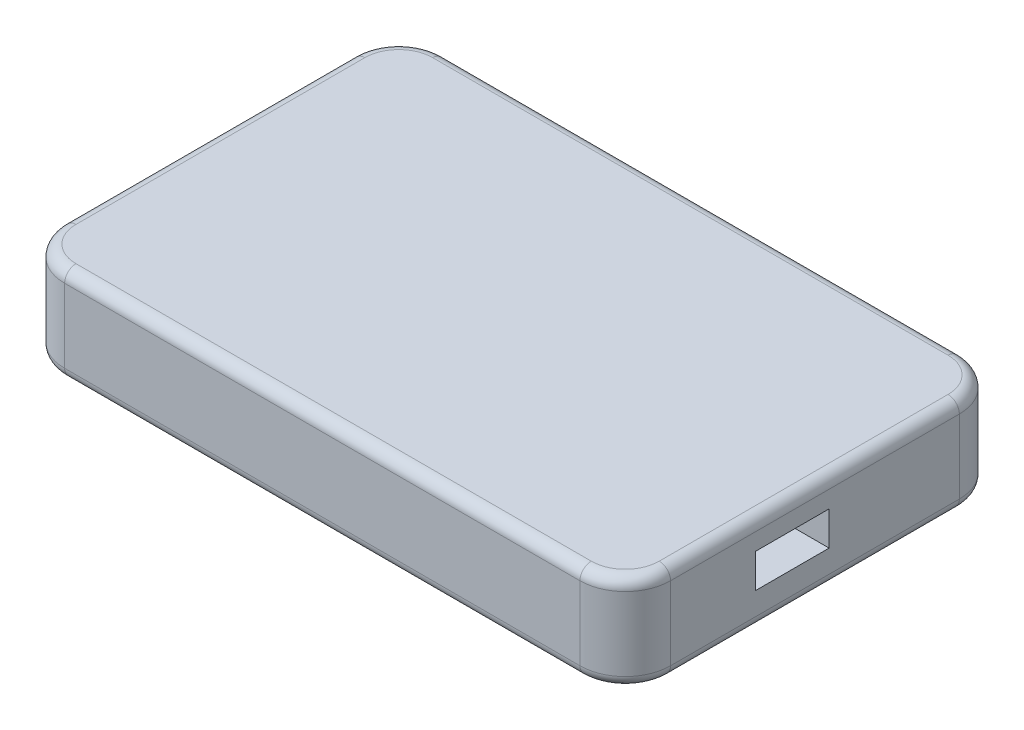
from build123d import *

# Parameters (mm, degrees)
SKETCH1_W           = 67
SKETCH1_H           = 17
BOSS_EXTRUDE1_DEPTH = 53.5
FILLET1_R           = 2
FILLET2_R           = 8
SKETCH2_W           = 13
SKETCH2_H           = 6
CUT_EXTRUDE1_DEPTH  = 8


with BuildPart() as part:
    # Sketch1 → Boss-Extrude1 (new, symmetric)
    with BuildSketch(Plane(origin=(0, 0, 0), x_dir=(0, 0, -1), z_dir=(1, 0, 0))):
        with Locations((33.5, 8.5)):
            Rectangle(SKETCH1_W, SKETCH1_H)
    extrude(amount=BOSS_EXTRUDE1_DEPTH, both=True)

    # Fillet1
    fillet1_edges = [part.edges().sort_by_distance(p)[0] for p in [
        (53.5, 17, -33.5),
        (-53.5, 17, -33.5),
        (-53.5, 0, -33.5),
        (0, 17, 0),
        (0, 17, -67),
        (0, 0, -67),
        (0, 0, 0),
        (53.5, 0, -33.5),
    ]]
    fillet(fillet1_edges, radius=FILLET1_R)

    # Fillet2
    # the kernel refuses this fillet: 8 mm, written as the material it takes off along each edge
    with BuildSketch(Plane(origin=(45.5, 0, -8), x_dir=(1, 0, 0), z_dir=(0, 0, -1))) as fillet2_piece_1:
        with BuildLine():
            CenterArc((6, -2), 2, 0, 90)
            Line((8, -2), (8, 0))
            Line((8, 0), (6, 0))
        make_face()
    revolve(axis=Axis((45.5, 0, -8), (0, -1, 0)), revolution_arc=90, mode=Mode.SUBTRACT)
    with BuildSketch(Plane(origin=(45.5, 0, -59), x_dir=(0, 0, -1), z_dir=(-1, 0, 0))) as fillet2_piece_2:
        with BuildLine():
            CenterArc((6, -2), 2, 0, 90)
            Line((8, -2), (8, 0))
            Line((8, 0), (6, 0))
        make_face()
    revolve(axis=Axis((45.5, 0, -59), (0, -1, 0)), revolution_arc=90, mode=Mode.SUBTRACT)
    with BuildSketch(Plane(origin=(-45.5, 0, -8), x_dir=(0, 0, 1), z_dir=(1, 0, 0))) as fillet2_piece_3:
        with BuildLine():
            CenterArc((6, -2), 2, 0, 90)
            Line((8, -2), (8, 0))
            Line((8, 0), (6, 0))
        make_face()
    revolve(axis=Axis((-45.5, 0, -8), (0, -1, 0)), revolution_arc=90, mode=Mode.SUBTRACT)
    with BuildSketch(Plane(origin=(-45.5, 0, -59), x_dir=(-1, 0, 0), z_dir=(0, 0, 1))) as fillet2_piece_4:
        with BuildLine():
            CenterArc((6, -2), 2, 0, 90)
            Line((8, -2), (8, 0))
            Line((8, 0), (6, 0))
        make_face()
    revolve(axis=Axis((-45.5, 0, -59), (0, -1, 0)), revolution_arc=90, mode=Mode.SUBTRACT)
    with BuildSketch(Plane(origin=(45.5, 17, -59), x_dir=(1, 0, 0), z_dir=(0, 0, 1))) as fillet2_piece_5:
        with BuildLine():
            CenterArc((6, -2), 2, 0, 90)
            Line((8, -2), (8, 0))
            Line((8, 0), (6, 0))
        make_face()
    revolve(axis=Axis((45.5, 17, -59), (0, 1, 0)), revolution_arc=90, mode=Mode.SUBTRACT)
    with BuildSketch(Plane(origin=(45.5, 17, -8), x_dir=(0, 0, 1), z_dir=(-1, 0, 0))) as fillet2_piece_6:
        with BuildLine():
            CenterArc((6, -2), 2, 0, 90)
            Line((8, -2), (8, 0))
            Line((8, 0), (6, 0))
        make_face()
    revolve(axis=Axis((45.5, 17, -8), (0, 1, 0)), revolution_arc=90, mode=Mode.SUBTRACT)
    with BuildSketch(Plane(origin=(-45.5, 17, -59), x_dir=(0, 0, -1), z_dir=(1, 0, 0))) as fillet2_piece_7:
        with BuildLine():
            CenterArc((6, -2), 2, 0, 90)
            Line((8, -2), (8, 0))
            Line((8, 0), (6, 0))
        make_face()
    revolve(axis=Axis((-45.5, 17, -59), (0, 1, 0)), revolution_arc=90, mode=Mode.SUBTRACT)
    with BuildSketch(Plane(origin=(-45.5, 17, -8), x_dir=(-1, 0, 0), z_dir=(0, 0, -1))) as fillet2_piece_8:
        with BuildLine():
            CenterArc((6, -2), 2, 0, 90)
            Line((8, -2), (8, 0))
            Line((8, 0), (6, 0))
        make_face()
    revolve(axis=Axis((-45.5, 17, -8), (0, 1, 0)), revolution_arc=90, mode=Mode.SUBTRACT)
    with BuildSketch(Plane(origin=(-53.5, 17, 0), x_dir=(0, 0, -1), z_dir=(0, -1, 0)), Plane(origin=(-53.5, 0, -67), x_dir=(0, 0, 1), z_dir=(0, 1, 0)), Plane(origin=(53.5, 17, 0), x_dir=(-1, 0, 0), z_dir=(0, -1, 0)), Plane(origin=(53.5, 0, -67), x_dir=(-1, 0, 0), z_dir=(0, 1, 0))) as fillet2_piece_9:
        with BuildLine():
            CenterArc((FILLET2_R, FILLET2_R), FILLET2_R, 180, 90)
            Line((0, FILLET2_R), (0, 0))
            Line((0, 0), (FILLET2_R, 0))
        make_face()
    extrude(amount=17, mode=Mode.SUBTRACT)

    # Sketch2 → Cut-Extrude1 (cut)
    with BuildSketch(Plane(origin=(53.5, 0, 0), x_dir=(0, 0, -1), z_dir=(1, 0, 0))):
        with Locations((29.5, 9)):
            Rectangle(SKETCH2_W, SKETCH2_H)
    extrude(amount=-CUT_EXTRUDE1_DEPTH, mode=Mode.SUBTRACT)


solid = part.part
